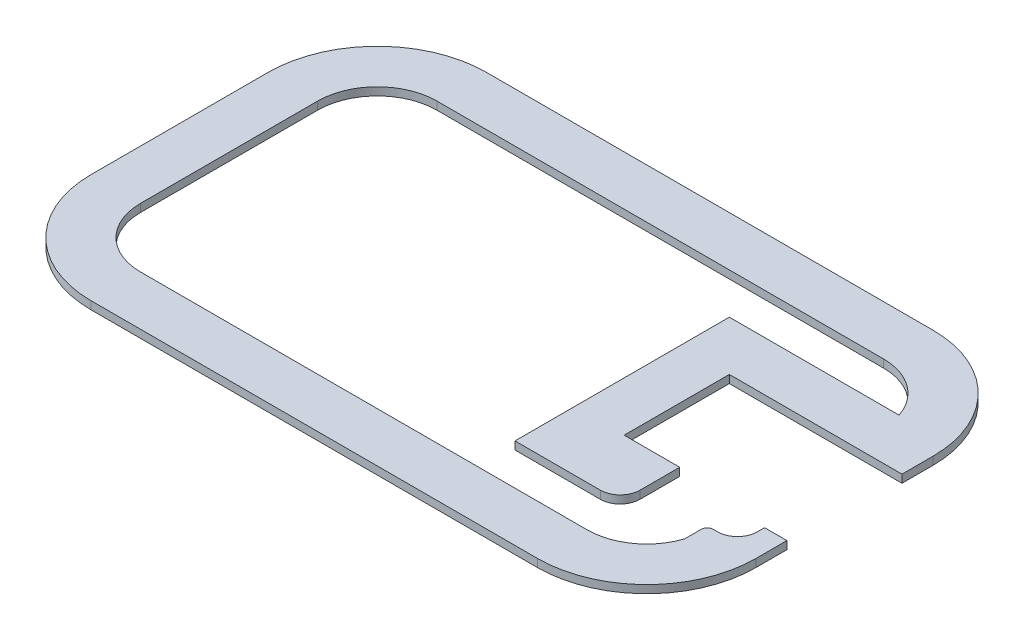
from build123d import *

# Parameters (mm, degrees)
BOSS_EXTRUDE1_DEPTH = 4


with BuildPart() as part:
    # Sketch1 → Boss-Extrude1 (new body)
    with BuildSketch(Plane(origin=(0, 0, 0), x_dir=(1, 0, 0), z_dir=(0, 1, 0))):
        with BuildLine():
            Line((285.295698998, -100.459464193), (285.295698998, -116.089464193))
            ThreePointArc((285.295698998, -116.089464193), (269.186571963, -154.980337158), (230.295698998, -171.089464193))
            Line((230.295698998, -171.089464193), (5.265698998, -171.089464193))
            ThreePointArc((5.265698998, -171.089464193), (-33.625173967, -154.980337158), (-49.734301002, -116.089464193))
            Line((-49.734301002, -116.089464193), (-49.734301002, -26.829464193))
            ThreePointArc((-49.734301002, -26.829464193), (-33.625173967, 12.061408773), (5.265698998, 28.170535807))
            Line((5.265698998, 28.170535807), (230.295698998, 28.170535807))
            ThreePointArc((230.295698998, 28.170535807), (269.186571963, 12.061408773), (285.295698998, -26.829464193))
            Line((285.295698998, -26.829464193), (285.295698998, -42.459464193))
            Line((285.295698998, -42.459464193), (198.295698998, -42.459464193))
            Line((198.295698998, -42.459464193), (198.295698998, -95.459464193))
            Line((198.295698998, -95.459464193), (226.295698998, -95.459464193))
            Line((226.295698998, -95.459464193), (226.295698998, -115.459464193))
            ThreePointArc((226.295698998, -115.459464193), (223.36676681, -122.530532004), (216.295698998, -125.459464193))
            Line((216.295698998, -125.459464193), (188.295698998, -125.459464193))
            Line((188.295698998, -125.459464193), (173.295698998, -125.459464193))
            Line((173.295698998, -125.459464193), (173.295698998, -17.459464193))
            Line((173.295698998, -17.459464193), (258.794876179, -17.459464193))
            ThreePointArc((258.794876179, -17.459464193), (247.886889975, -2.528229656), (230.295698998, 3.170535807))
            Line((230.295698998, 3.170535807), (5.265698998, 3.170535807))
            ThreePointArc((5.265698998, 3.170535807), (-15.947504438, -5.616260757), (-24.734301002, -26.829464193))
            Line((-24.734301002, -26.829464193), (-24.734301002, -116.089464193))
            ThreePointArc((-24.734301002, -116.089464193), (-15.947504438, -137.302667628), (5.265698998, -146.089464193))
            Line((5.265698998, -146.089464193), (230.295698998, -146.089464193))
            ThreePointArc((230.295698998, -146.089464193), (247.886889975, -140.390698729), (258.794876179, -125.459464193))
            Line((258.794876179, -125.459464193), (258.794876179, -117.089464193))
            ThreePointArc((258.794876179, -117.089464193), (259.673555836, -114.968143849), (261.794876179, -114.089464193))
            Line((261.794876179, -114.089464193), (264.045287589, -114.089464193))
            ThreePointArc((264.045287589, -114.089464193), (271.1163554, -111.160532004), (274.045287589, -104.089464193))
            Line((274.045287589, -104.089464193), (274.045287589, -100.459464193))
            Line((274.045287589, -100.459464193), (285.295698998, -100.459464193))
        make_face()
    extrude(amount=BOSS_EXTRUDE1_DEPTH)


solid = part.part
